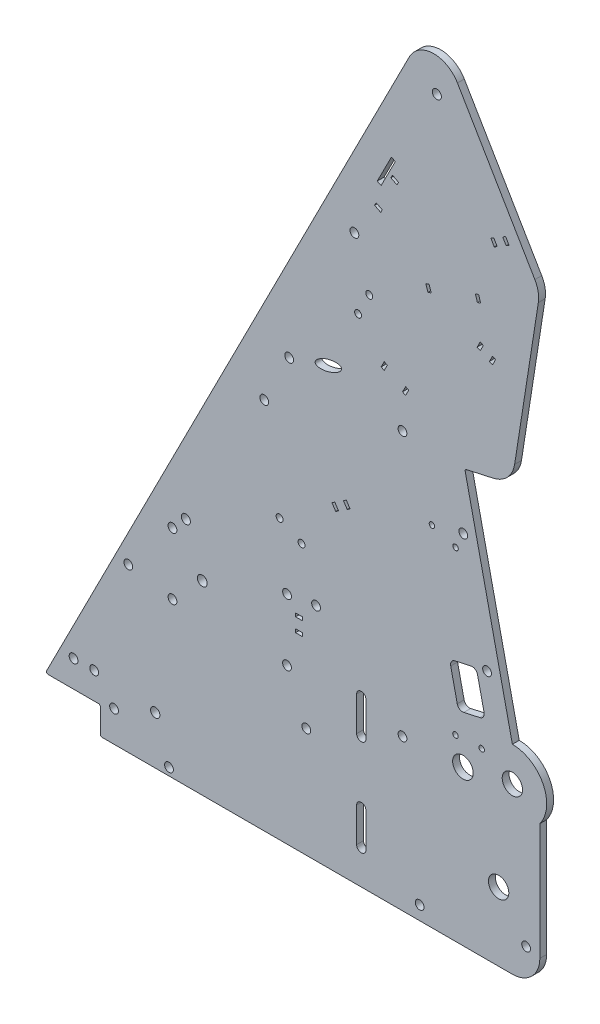
from build123d import *

# Parameters (mm, degrees)
BOSS_EXTRUDE1_DEPTH     = 3.175
SKETCH2_R               = 2.0955
SKETCH2_R_2             = 2.286
SKETCH2_R_3             = 2.032
SKETCH2_R_4             = 4.699
CUT_EXTRUDE1_DEPTH      = 421.976111717
SKETCH7_R               = 2.159
CUT_EXTRUDE2_DEPTH      = 421.976111717
CUT_EXTRUDE3_REACH      = 422.976
SKETCH10_R              = 2.032
FILLET1_R               = 12.7
FILLET2_R               = 0.79375
SKETCH12_R              = 2.032
CUT_EXTRUDE5_DEPTH      = 410.593447353
SKETCH13_R              = 2.032
SKETCH13_R_2            = 1.6
SKETCH13_RX             = 6.35
SKETCH13_RY             = 2.38125
SKETCH13_W              = 3.175
SKETCH13_H              = 1.5875
CUT_EXTRUDE6_DEPTH      = 410.593447353
CUT_EXTRUDE7_DEPTH      = 410.593447493
CUT_EXTRUDE7_DEPTH_BACK = 410.593447493
SKETCH14_R              = 1.27
SKETCH14_R_2            = 2.032
FILLET3_R               = 2.54
SKETCH15_R              = 4.7625
CUT_EXTRUDE8_DEPTH      = 410.593447493


with BuildPart() as part:
    # Sketch1 → Boss-Extrude1 (new body)
    with BuildSketch(Plane.XY):
        with BuildLine():
            Line((228.6, -12.7), (228.6, 53.975))
            ThreePointArc((228.6, 53.975), (230.099031657, 70.599515829), (215.9, 79.375))
            Line((215.9, 79.375), (193.909735224, 178.566674323))
            Line((193.909735224, 178.566674323), (215.607913982, 183.377044743))
            Line((215.607913982, 183.377044743), (228.6, 266.7))
            Line((228.6, 266.7), (178.754725958, 351.413083686))
            Line((178.754725958, 351.413083686), (0, 0))
            Line((0, 0), (25.4, 0))
            Line((25.4, 0), (25.4, -12.7))
            Line((25.4, -12.7), (228.6, -12.7))
        make_face()
    extrude(amount=BOSS_EXTRUDE1_DEPTH)

    # Sketch2 → Cut-Extrude1 (cut, through all)
    with BuildSketch(Plane.XY.offset(3.175)):
        with Locations((64.943150167, 94.057839899)):
            Circle(SKETCH2_R)
        with Locations((180.975, 322.164313376)):
            Circle(SKETCH2_R)
        with Locations((72.544547852, 73.173171402)):
            Circle(SKETCH2_R_2)
        with Locations((193.207821773, 152.394364194)):
            Circle(SKETCH2_R_3)
        with Locations((215.9, 63.5)):
            Circle(SKETCH2_R_4)
        with Locations((173.0375, -6.35)):
            Circle(SKETCH2_R_3)
        with Locations((204.202954161, 102.798527032)):
            Circle(SKETCH2_R_3)
        with Locations((209.55, 19.05)):
            Circle(SKETCH2_R_4)
        with Locations((165.1, 179.3875)):
            Circle(SKETCH2_R_3)
        with Locations((111.724047852, 87.460671402)):
            Circle(SKETCH2_R_3)
        with Locations((111.724047852, 58.885671402)):
            Circle(SKETCH2_R_3)
        with Locations((58.765047852, 58.885671402)):
            Circle(SKETCH2_R_3)
        with Locations((58.765047852, 87.460671402)):
            Circle(SKETCH2_R_3)
    extrude(amount=-CUT_EXTRUDE1_DEPTH, mode=Mode.SUBTRACT)

    # Sketch7 → Cut-Extrude2 (cut, through all)
    with BuildSketch(Plane.XY.offset(3.175)):
        with Locations((50.8, 9.525)):
            Circle(SKETCH7_R)
        with BuildLine():
            Line((143.891, 3.175), (143.891, 19.05))
            ThreePointArc((143.891, 19.05), (146.05, 21.209), (148.209, 19.05))
            Line((148.209, 19.05), (148.209, 3.175))
            ThreePointArc((148.209, 3.175), (146.05, 1.016), (143.891, 3.175))
        make_face()
        with BuildLine():
            Line((143.891, 47.625), (143.891, 63.5))
            ThreePointArc((143.891, 63.5), (146.05, 65.659), (148.209, 63.5))
            Line((148.209, 63.5), (148.209, 47.625))
            ThreePointArc((148.209, 47.625), (146.05, 45.466), (143.891, 47.625))
        make_face()
    extrude(amount=-CUT_EXTRUDE2_DEPTH, mode=Mode.SUBTRACT)

    # Sketch10 → Cut-Extrude3 (cut, up to next)
    with BuildSketch(Plane.XY.offset(3.175), mode=Mode.PRIVATE) as cut_extrude3_sk1:
        with Locations((120.65, 38.1)):
            Circle(SKETCH10_R)
    cut_extrude3_tool1 = extrude(cut_extrude3_sk1.sketch, amount=-CUT_EXTRUDE3_REACH, mode=Mode.PRIVATE) & part.part
    # Sketch10 → Cut-Extrude3 (cut, up to next)
    with BuildSketch(Plane.XY.offset(3.175), mode=Mode.PRIVATE) as cut_extrude3_sk2:
        with Locations((165.1, 57.15)):
            Circle(SKETCH10_R)
    cut_extrude3_tool2 = extrude(cut_extrude3_sk2.sketch, amount=-CUT_EXTRUDE3_REACH, mode=Mode.PRIVATE) & part.part
    # Sketch10 → Cut-Extrude3 (cut, up to next)
    with BuildSketch(Plane.XY.offset(3.175), mode=Mode.PRIVATE) as cut_extrude3_sk3:
        with Locations((13.046467246, 12.334704411)):
            Circle(SKETCH10_R)
    cut_extrude3_tool3 = extrude(cut_extrude3_sk3.sketch, amount=-CUT_EXTRUDE3_REACH, mode=Mode.PRIVATE) & part.part
    # Sketch10 → Cut-Extrude3 (cut, up to next)
    with BuildSketch(Plane.XY.offset(3.175), mode=Mode.PRIVATE) as cut_extrude3_sk4:
        with Locations((22.571467246, 12.334704411)):
            Circle(SKETCH10_R)
    cut_extrude3_tool4 = extrude(cut_extrude3_sk4.sketch, amount=-CUT_EXTRUDE3_REACH, mode=Mode.PRIVATE) & part.part
    # Sketch10 → Cut-Extrude3 (cut, up to next)
    with BuildSketch(Plane.XY.offset(3.175), mode=Mode.PRIVATE) as cut_extrude3_sk5:
        with Locations((38.360434174, 62.564025462)):
            Circle(SKETCH10_R)
    cut_extrude3_tool5 = extrude(cut_extrude3_sk5.sketch, amount=-CUT_EXTRUDE3_REACH, mode=Mode.PRIVATE) & part.part
    add(cut_extrude3_tool1.solids().sort_by_distance((120.65, 38.1, 3.175))[0], mode=Mode.SUBTRACT)
    add(cut_extrude3_tool2.solids().sort_by_distance((165.1, 57.15, 3.175))[0], mode=Mode.SUBTRACT)
    add(cut_extrude3_tool3.solids().sort_by_distance((13.046467, 12.334704, 3.175))[0], mode=Mode.SUBTRACT)
    add(cut_extrude3_tool4.solids().sort_by_distance((22.571467, 12.334704, 3.175))[0], mode=Mode.SUBTRACT)
    add(cut_extrude3_tool5.solids().sort_by_distance((38.360434, 62.564025, 3.175))[0], mode=Mode.SUBTRACT)

    # Fillet1
    fillet1_edges = [part.edges().sort_by_distance(p)[0] for p in [
        (228.6, -12.7, 1.5875),
        (178.754725958, 351.413083686, 1.5875),
        (215.607913982, 183.377044743, 1.5875),
        (228.6, 266.7, 1.5875),
    ]]
    fillet(fillet1_edges, radius=FILLET1_R)

    # Fillet2
    fillet2_edges = [part.edges().sort_by_distance(p)[0] for p in [
        (25.4, -12.7, 1.5875),
        (25.4, 0, 1.5875),
        (193.909735224, 178.566674323, 1.5875),
        (0, 0, 1.5875),
    ]]
    fillet(fillet2_edges, radius=FILLET2_R)

    # Sketch12 → Cut-Extrude5 (cut, through all)
    with BuildSketch(Plane.XY.offset(3.175)):
        with Locations((31.75, 1.5875)):
            Circle(SKETCH12_R)
        with Locations((173.0375, -6.35)):
            Circle(SKETCH12_R)
        with Locations((222.25, 1.5875)):
            Circle(SKETCH12_R)
        with Locations((57.15, -9.2075)):
            Circle(SKETCH12_R)
    extrude(amount=-CUT_EXTRUDE5_DEPTH, mode=Mode.SUBTRACT)

    # Sketch13 → Cut-Extrude6 (cut, through all)
    with BuildSketch(Plane.XY.offset(3.175)):
        with Locations((112.7125, 182.5625)):
            Circle(SKETCH13_R)
        with Locations((101.196445848, 159.923142748)):
            Circle(SKETCH13_R)
        with Locations((144.564924562, 216.045959878)):
            Circle(SKETCH13_R_2)
        with Locations((149.733547292, 226.206931243)):
            Circle(SKETCH13_R_2)
        with Locations((108.294003262, 116.150198589)):
            Circle(SKETCH13_R_2)
        with Locations((118.454974627, 110.981575859)):
            Circle(SKETCH13_R_2)
        with Locations((142.875, 247.65)):
            Circle(SKETCH13_R)
        with Locations(Location((130.826142263, 188.461522288), (0, 0, 18.038739462))):
            Ellipse(SKETCH13_RX, SKETCH13_RY)
        Polygon((177.409251759, 244.300646718), (175.897759266, 243.815315188), (176.868422327, 240.792330202), (178.37991482, 241.277661733), align=None)
        Polygon((159.987235489, 286.506830939), (153.423084623, 273.602397305), (155.205711178, 272.695621388), (161.769862045, 285.600055021), align=None)
        Polygon((199.749157586, 248.139202459), (201.260650079, 248.62453399), (200.289987018, 251.647518975), (198.778494525, 251.162187445), align=None)
        Polygon((159.730005627, 278.088494461), (162.559925284, 276.648987692), (163.279678668, 278.06394752), (160.449759012, 279.503454289), align=None)
        Polygon((152.929186246, 264.718795297), (152.209432862, 263.303835468), (155.039352518, 261.8643287), (155.759105903, 263.279288528), align=None)
        Polygon((202.469865571, 232.338320106), (201.054905742, 233.058073491), (199.615398973, 230.228153834), (201.030358802, 229.50840045), align=None)
        Polygon((205.275238286, 227.349140296), (206.690198115, 226.629386912), (208.129704884, 229.459306568), (206.714745055, 230.179059953), align=None)
        Polygon((212.77456731, 281.074117833), (211.406345913, 280.269054818), (213.016471942, 277.532612023), (214.384693339, 278.337675038), align=None)
        Polygon((207.30168172, 277.853865775), (205.933460322, 277.048802761), (207.543586351, 274.312359966), (208.911807749, 275.11742298), align=None)
        Polygon((132.489957679, 134.410403403), (134.220986607, 131.748794143), (135.551791237, 132.614308608), (133.820762308, 135.275917867), align=None)
        Polygon((155.228084113, 200.119678264), (156.643043941, 199.39992488), (158.08255071, 202.229844536), (156.667590882, 202.949597921), align=None)
        Polygon((165.132802911, 195.081404573), (166.547762739, 194.361651188), (167.987269508, 197.191570845), (166.57230968, 197.911324229), align=None)
        Polygon((139.544205126, 135.210852001), (137.813176197, 137.87246126), (139.143980826, 138.737975724), (140.875009755, 136.076366465), align=None)
        with Locations((117.248547852, 81.078921402)):
            Rectangle(SKETCH13_W, SKETCH13_H)
        with Locations((117.248547852, 74.728921402)):
            Rectangle(SKETCH13_W, SKETCH13_H)
    extrude(amount=-CUT_EXTRUDE6_DEPTH, mode=Mode.SUBTRACT)

    # Sketch14 → Cut-Extrude7 (cut, two sides: drawn at the far end of the back side and taken through both)
    with BuildSketch(Plane.XY.offset(3.175).offset(-CUT_EXTRUDE7_DEPTH_BACK)):
        with Locations((189.602197334, 69.980636704)):
            Circle(SKETCH14_R)
        with Locations((201.708862449, 70.509225118)):
            Circle(SKETCH14_R)
        with Locations((165.1, 57.15)):
            Circle(SKETCH14_R_2)
        with Locations((125.14977438, 89.522927623)):
            Circle(SKETCH14_R_2)
        with Locations((178.721644858, 148.532438598)):
            Circle(SKETCH14_R)
        with Locations((189.622629605, 145.09537131)):
            Circle(SKETCH14_R)
        Polygon((186.844411154, 98.950230697), (199.243370445, 101.699013794), (203.36654509, 83.100574858), (190.9675858, 80.351791761), align=None)
    extrude(amount=CUT_EXTRUDE7_DEPTH + CUT_EXTRUDE7_DEPTH_BACK, mode=Mode.SUBTRACT)

    # Fillet3
    fillet3_edges = [part.edges().sort_by_distance(p)[0] for p in [
        (199.243370445, 101.699013794, 1.5875),
        (186.844411154, 98.950230697, 1.5875),
        (190.9675858, 80.351791761, 1.5875),
        (203.36654509, 83.100574858, 1.5875),
    ]]
    fillet(fillet3_edges, radius=FILLET3_R)

    # Sketch15 → Cut-Extrude8 (cut, through all)
    with BuildSketch(Plane.XY.offset(3.175)):
        with Locations((193.04, 58.801)):
            Circle(SKETCH15_R)
    extrude(amount=-CUT_EXTRUDE8_DEPTH, mode=Mode.SUBTRACT)


solid = part.part
